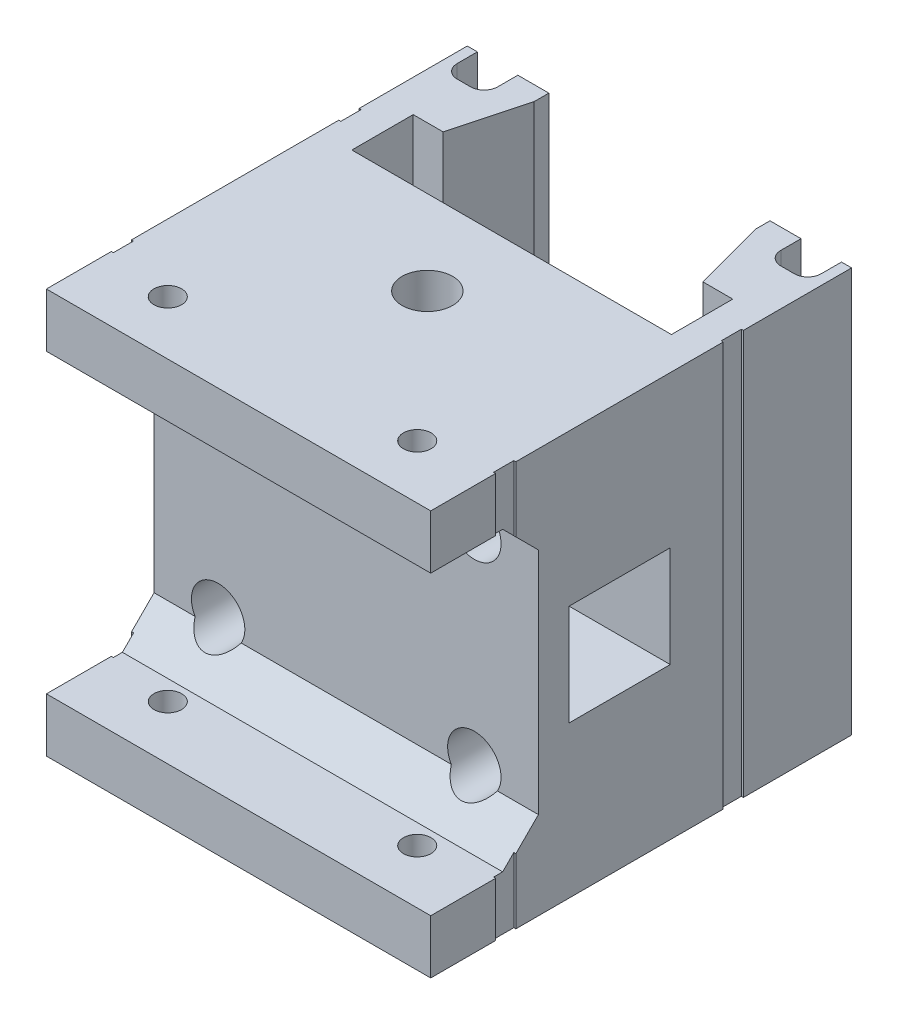
from build123d import *

# Parameters (mm, degrees)
SKETCH1_W            = 57
SKETCH1_H            = 28.7
BOSS_EXTRUDE1_DEPTH  = 60
SKETCH2_W            = 9
SKETCH2_H            = 4
CUT_EXTRUDE1_DEPTH   = 69.064473112
BOSS_EXTRUDE2_DEPTH  = 28.5
SKETCH6_W            = 15.5
SKETCH6_H            = 15.390476131
CUT_EXTRUDE2_DEPTH   = 80
BOSS_EXTRUDE5_DEPTH  = 60
SKETCH10_R           = 2
CUT_EXTRUDE3_DEPTH   = 24.530533394
SKETCH11_W           = 61.984050455
SKETCH11_H           = 43.227353824
SKETCH11_W_2         = 6
SKETCH11_H_2         = 2.542732203
CUT_EXTRUDE4_DEPTH   = 77.839254789
SKETCH13_W           = 6.011053281
SKETCH13_H           = 2.620549071
CUT_EXTRUDE5_DEPTH   = 77.839254789
SKETCH14_W           = 9
SKETCH14_H           = 4
BOSS_EXTRUDE7_DEPTH  = 60
SKETCH12_W           = 10.230058637
SKETCH12_H           = 6.686923691
BOSS_EXTRUDE6_DEPTH  = 60
SKETCH15_W           = 9
SKETCH15_H           = 4
BOSS_EXTRUDE8_DEPTH  = 60
SKETCH16_W           = 9
SKETCH16_H           = 1.78
CUT_EXTRUDE6_DEPTH   = 77.839254789
SKETCH17_W           = 25.75
SKETCH17_H           = 20.1006285
CUT_EXTRUDE7_DEPTH   = 77.839254789
SKETCH18_W           = 32.4
SKETCH18_H           = 12.613288226
CUT_EXTRUDE8_DEPTH   = 75.79485996
SKETCH19_W           = 57
SKETCH19_H           = 3.949842852
CUT_EXTRUDE9_DEPTH   = 75.79485996
SKETCH20_W           = 6
SKETCH20_H           = 3.5
CUT_EXTRUDE10_DEPTH  = 75.79485996
SKETCH21_W           = 6
SKETCH21_H           = 3.5
CUT_EXTRUDE11_DEPTH  = 1.5
SKETCH23_R           = 3.75
CUT_EXTRUDE12_DEPTH  = 59.313986952
SKETCH24_R           = 2
CUT_EXTRUDE13_DEPTH  = 59.313986952
SKETCH25_R           = 3.960956754
CUT_EXTRUDE14_DEPTH  = 10
SKETCH26_W           = 6
SKETCH26_H           = 10
SKETCH26_H_2         = 15
CUT_EXTRUDE15_DEPTH  = 5
SKETCH28_W           = 15.020317418
SKETCH28_H           = 14.99999997
CUT_EXTRUDE18_DEPTH  = 90.615964406
SKETCH32_W           = 57
SKETCH32_H           = 8
BOSS_EXTRUDE10_DEPTH = 15.97
SKETCH33_R           = 2.05
CUT_EXTRUDE20_DEPTH  = 84.351222025
FILLET2_R            = 2
CHAMFER1_SIZE        = 5
CUT_EXTRUDE21_DEPTH  = 84.351222025
SKETCH36_W           = 0.6
SKETCH36_H           = 3
CUT_EXTRUDE22_DEPTH  = 84.351222025


with BuildPart() as part:
    # Sketch1 → Boss-Extrude1 (new body)
    with BuildSketch(Plane(origin=(0, 0, 0), x_dir=(1, 0, 0), z_dir=(0, 1, 0))):
        with Locations((0, -0.5)):
            Rectangle(SKETCH1_W, SKETCH1_H)
        Polygon((23.07, -9.85), (-23.07, -9.85), (-23.5, -9.42), (-23.5, -0.95), (-19.09385128, -0.95), (-19, -0.599742255), (-16.2, 9.85), (16.2, 9.85), (19, -0.599742255), (19.09385128, -0.95), (23.5, -0.95), (23.5, -2.9), (23.5, -9.42), align=None, mode=Mode.SUBTRACT)
    extrude(amount=BOSS_EXTRUDE1_DEPTH)

    # Sketch2 → Cut-Extrude1 (cut, through all)
    with BuildSketch(Plane.XZ):
        with Locations((24, -10.0706285)):
            Rectangle(SKETCH2_W, SKETCH2_H)
        with Locations((-24, -10.0706285)):
            Rectangle(SKETCH2_W, SKETCH2_H)
    extrude(amount=-CUT_EXTRUDE1_DEPTH, mode=Mode.SUBTRACT)

    # Sketch5 → Boss-Extrude2 (add, symmetric)
    with BuildSketch(Plane(origin=(0, 0, 0), x_dir=(0, 0, -1), z_dir=(1, 0, 0))):
        with BuildLine():
            Line((-14.85, 0), (-14.85, 23.200000017))
            Line((-14.85, 23.200000017), (-15.549999973, 22.50000003))
            Line((-15.549999973, 22.50000003), (-29.149999973, 22.50000003))
            Line((-29.149999973, 22.50000003), (-29.849999973, 23.20000003))
            Line((-29.849999973, 23.20000003), (-29.849999973, 25.743360053))
            ThreePointArc((-29.849999973, 25.743360053), (-29.773879502, 26.126043492), (-29.557106746, 26.450466847))
            Line((-29.557106746, 26.450466847), (-27.237157266, 28.770416328))
            ThreePointArc((-27.237157266, 28.770416328), (-27.150448162, 28.900185674), (-27.119999973, 29.053259055))
            Line((-27.119999973, 29.053259055), (-27.119999973, 30.615319642))
            ThreePointArc((-27.119999973, 30.615319642), (-27.150448164, 30.768393021), (-27.237157268, 30.898162365))
            Line((-27.237157268, 30.898162365), (-27.431588163, 31.09259326))
            ThreePointArc((-27.431588163, 31.09259326), (-27.613507965, 31.297692563), (-27.620638933, 31.57175403))
            ThreePointArc((-27.620638933, 31.57175403), (-28.017573243, 32.42857618), (-28.828543655, 32.91234062))
            ThreePointArc((-28.828543655, 32.91234062), (-29.01918836, 33.020436377), (-29.124259054, 33.212764861))
            Line((-29.124259054, 33.212764861), (-29.156235284, 33.354092333))
            ThreePointArc((-29.156235284, 33.354092333), (-29.24659278, 33.53064407), (-29.410649592, 33.642090719))
            Line((-29.410649592, 33.642090719), (-29.585724304, 33.70524196))
            ThreePointArc((-29.585724304, 33.70524196), (-29.777329878, 33.851609246), (-29.849999973, 34.081511694))
            Line((-29.849999973, 34.081511694), (-29.849999973, 34.837490602))
            ThreePointArc((-29.849999973, 34.837490602), (-29.772088513, 35.074680338), (-29.568705112, 35.219471078))
            Line((-29.568705112, 35.219471078), (-29.427668799, 35.263299846))
            ThreePointArc((-29.427668799, 35.263299846), (-29.25116358, 35.375371369), (-29.155313737, 35.561185593))
            Line((-29.155313737, 35.561185593), (-29.125010632, 35.702102112))
            ThreePointArc((-29.125010632, 35.702102112), (-29.020526118, 35.897067182), (-28.828406063, 36.006695082))
            ThreePointArc((-28.828406063, 36.006695082), (-28.025619489, 36.481556021), (-27.62403672, 37.32339358))
            ThreePointArc((-27.62403672, 37.32339358), (-27.540484938, 37.407225271), (-27.43605838, 37.46293655))
            Line((-27.43605838, 37.46293655), (-27.39899493, 37.5))
            Line((-27.39899493, 37.5), (-17.30100503, 37.5))
            Line((-17.30100503, 37.5), (-17.26394158, 37.46293655))
            ThreePointArc((-17.26394158, 37.46293655), (-17.159515017, 37.407225278), (-17.07596324, 37.32339358))
            ThreePointArc((-17.07596324, 37.32339358), (-16.674380468, 36.481556018), (-15.871593887, 36.006695079))
            ThreePointArc((-15.871593887, 36.006695079), (-15.679473839, 35.897067189), (-15.574989331, 35.702102127))
            Line((-15.574989331, 35.702102127), (-15.544686222, 35.561185587))
            ThreePointArc((-15.544686222, 35.561185587), (-15.448836377, 35.375371364), (-15.272331158, 35.263299843))
            Line((-15.272331158, 35.263299843), (-15.131294869, 35.219471083))
            ThreePointArc((-15.131294869, 35.219471083), (-14.927911462, 35.074680333), (-14.85, 34.837490586))
            Line((-14.85, 34.837490586), (-14.85, 60))
            Line((-14.85, 60), (-34.380533394, 60))
            Line((-34.380533394, 60), (-34.380533394, 0))
            Line((-34.380533394, 0), (-14.85, 0))
        make_face()
        with BuildLine():
            ThreePointArc((-15.142893227, 26.450466847), (-14.926120471, 26.126043492), (-14.85, 25.743360053))
            Line((-14.85, 25.743360053), (-14.85, 34.081511674))
            ThreePointArc((-14.85, 34.081511674), (-14.922670087, 33.851609245), (-15.114275644, 33.70524197))
            Line((-15.114275644, 33.70524197), (-15.289350386, 33.642090718))
            ThreePointArc((-15.289350386, 33.642090718), (-15.453407192, 33.53064407), (-15.543764688, 33.354092339))
            Line((-15.543764688, 33.354092339), (-15.57574092, 33.21276486))
            ThreePointArc((-15.57574092, 33.21276486), (-15.680811613, 33.020436377), (-15.871456319, 32.91234062))
            ThreePointArc((-15.871456319, 32.91234062), (-16.68242673, 32.42857618), (-17.07936104, 31.57175403))
            ThreePointArc((-17.07936104, 31.57175403), (-17.086492012, 31.297692565), (-17.26841181, 31.09259326))
            Line((-17.26841181, 31.09259326), (-17.462842708, 30.898162362))
            ThreePointArc((-17.462842708, 30.898162362), (-17.549551812, 30.768393016), (-17.58, 30.615319635))
            Line((-17.58, 30.615319635), (-17.58, 29.053259048))
            ThreePointArc((-17.58, 29.053259048), (-17.54955181, 28.900185669), (-17.462842705, 28.770416325))
            Line((-17.462842705, 28.770416325), (-15.142893227, 26.450466847))
        make_face()
    extrude(amount=BOSS_EXTRUDE2_DEPTH, both=True)

    # Sketch6 → Cut-Extrude2 (cut)
    with BuildSketch(Plane(origin=(0, 60, 0), x_dir=(1, 0, 0), z_dir=(0, 1, 0))):
        with Locations((0, 12.050145064)):
            Rectangle(SKETCH6_W, SKETCH6_H)
    extrude(amount=-CUT_EXTRUDE2_DEPTH, mode=Mode.SUBTRACT)

    # Sketch9 → Boss-Extrude5 (add)
    with BuildSketch(Plane(origin=(0, 60, 0), x_dir=(1, 0, 0), z_dir=(0, 1, 0))):
        Polygon((-19.5, 13.85), (-19.5, 29.1706285), (-28.5, 29.1706285), (-28.5, 26.1706285), (-33.5, 26.1706285), (-33.5, 32.1706285), (-14.5, 32.1706285), (-14.5, 13.85), align=None)
        Polygon((30.2, 12.85), (30.2, 28.735786438), (19.5, 28.735786438), (19.5, 13.85), (14.5, 13.85), (14.5, 32.1706285), (33.5, 32.1706285), (33.5, 12.85), align=None)
    extrude(amount=-BOSS_EXTRUDE5_DEPTH)

    # Sketch10 → Cut-Extrude3 (cut)
    with BuildSketch(Plane.XY.offset(34.380533394)):
        with Locations((19, 45)):
            Circle(SKETCH10_R)
        with Locations((19, 15)):
            Circle(SKETCH10_R)
        with Locations((-19, 15)):
            Circle(SKETCH10_R)
        with Locations((-19, 45)):
            Circle(SKETCH10_R)
    extrude(amount=-CUT_EXTRUDE3_DEPTH, mode=Mode.SUBTRACT)

    # Sketch11 → Cut-Extrude4 (cut, through all)
    with BuildSketch(Plane.XZ):
        with Locations((44.734239641, -35.463676912)):
            Rectangle(SKETCH11_W, SKETCH11_H)
        with Locations((32.2, -12.566438328)):
            Rectangle(SKETCH11_W_2, SKETCH11_H_2)
    extrude(amount=-CUT_EXTRUDE4_DEPTH, mode=Mode.SUBTRACT)


with BuildPart() as cut_extrude4_piece_1:
    # of the separate pieces the step leaves, piece 1, a body of its own (cut_extrude4_pieces)
    add(part.part.solids().sort_by_distance((-28.5, 23.200000017, 14.85))[0])

    # Sketch14 → Boss-Extrude7 (add, through all)
    with BuildSketch(Plane(origin=(0, 0, 0), x_dir=(-1, 0, 0), z_dir=(0, -1, 0))):
        with Locations((-24, 10.0706285)):
            Rectangle(SKETCH14_W, SKETCH14_H)
    extrude(amount=-BOSS_EXTRUDE7_DEPTH)

    # Sketch12 → Boss-Extrude6 (add, through all)
    with BuildSketch(Plane.XZ):
        with Locations((23.384970682, -10.506538155)):
            Rectangle(SKETCH12_W, SKETCH12_H)
    extrude(amount=-BOSS_EXTRUDE6_DEPTH)

    # Sketch15 → Boss-Extrude8 (add, through all)
    with BuildSketch(Plane(origin=(0, 60, 0), x_dir=(1, 0, 0), z_dir=(0, 1, 0))):
        with Locations((-24, 10.0706285)):
            Rectangle(SKETCH15_W, SKETCH15_H)
    extrude(amount=-BOSS_EXTRUDE8_DEPTH)

    # Sketch16 → Cut-Extrude6 (cut, through all)
    with BuildSketch(Plane(origin=(0, 60, 0), x_dir=(1, 0, 0), z_dir=(0, 1, 0))):
        with Locations((-24, 12.96)):
            Rectangle(SKETCH16_W, SKETCH16_H)
    extrude(amount=-CUT_EXTRUDE6_DEPTH, mode=Mode.SUBTRACT)

    # Sketch17 → Cut-Extrude7 (cut, through all)
    with BuildSketch(Plane(origin=(0, 60, 0), x_dir=(1, 0, 0), z_dir=(0, 1, 0))):
        with Locations((-20.625, 22.12031425)):
            Rectangle(SKETCH17_W, SKETCH17_H)
    extrude(amount=-CUT_EXTRUDE7_DEPTH, mode=Mode.SUBTRACT)

    # Sketch18 → Cut-Extrude8 (cut, through all)
    with BuildSketch(Plane(origin=(0, 60, 0), x_dir=(1, 0, 0), z_dir=(0, 1, 0))):
        with Locations((0, 16.156644113)):
            Rectangle(SKETCH18_W, SKETCH18_H)
    extrude(amount=-CUT_EXTRUDE8_DEPTH, mode=Mode.SUBTRACT)

    # Sketch19 → Cut-Extrude9 (cut, through all)
    with BuildSketch(Plane(origin=(0, 60, 0), x_dir=(1, 0, 0), z_dir=(0, 1, 0))):
        with Locations((0, 14.044921426)):
            Rectangle(SKETCH19_W, SKETCH19_H)
    extrude(amount=-CUT_EXTRUDE9_DEPTH, mode=Mode.SUBTRACT)

    # Sketch20 → Cut-Extrude10 (cut, through all)
    with BuildSketch(Plane(origin=(0, 60, 0), x_dir=(1, 0, 0), z_dir=(0, 1, 0))):
        with Locations((-24, 8.82)):
            Rectangle(SKETCH20_W, SKETCH20_H)
        with Locations((24, 8.82)):
            Rectangle(SKETCH20_W, SKETCH20_H)
    extrude(amount=-CUT_EXTRUDE10_DEPTH, mode=Mode.SUBTRACT)

    # Sketch21 → Cut-Extrude11 (cut)
    with BuildSketch(Plane(origin=(0, 0, -12.07), x_dir=(-1, 0, 0), z_dir=(0, 0, -1))):
        with Locations((-24, 48.25)):
            Rectangle(SKETCH21_W, SKETCH21_H)
        with Locations((24, 48.25)):
            Rectangle(SKETCH21_W, SKETCH21_H)
        with Locations((24, 11.75)):
            Rectangle(SKETCH21_W, SKETCH21_H)
        with Locations((-24, 11.75)):
            Rectangle(SKETCH21_W, SKETCH21_H)
    extrude(amount=-CUT_EXTRUDE11_DEPTH, mode=Mode.SUBTRACT)

    # Sketch23 → Cut-Extrude12 (cut, through all)
    with BuildSketch(Plane(origin=(0, 22.50000003, 0), x_dir=(1, 0, 0), z_dir=(0, 1, 0))):
        with Locations(Location((0, -22.349999973, 0), (0, 0, 90))):
            Circle(SKETCH23_R)
    extrude(amount=CUT_EXTRUDE12_DEPTH, mode=Mode.SUBTRACT)

    # Sketch24 → Cut-Extrude13 (cut, through all)
    with BuildSketch(Plane(origin=(0, 22.50000003, 0), x_dir=(1, 0, 0), z_dir=(0, 1, 0))):
        with Locations(Location((0, -22.349999973, 0), (0, 0, 270))):
            Circle(SKETCH24_R)
    extrude(amount=-CUT_EXTRUDE13_DEPTH, mode=Mode.SUBTRACT)

    # Sketch25 → Cut-Extrude14 (cut)
    with BuildSketch(Plane.XY.offset(34.380533394)):
        with Locations((19, 15)):
            Circle(SKETCH25_R)
        with Locations((-19, 15)):
            Circle(SKETCH25_R)
        with Locations((19, 45)):
            Circle(SKETCH25_R)
        with Locations((-19, 45)):
            Circle(SKETCH25_R)
    extrude(amount=-CUT_EXTRUDE14_DEPTH, mode=Mode.SUBTRACT)

    # Sketch26 → Cut-Extrude15 (cut)
    with BuildSketch(Plane(origin=(0, 0, -12.07), x_dir=(-1, 0, 0), z_dir=(0, 0, -1))):
        with Locations((24, 30)):
            Rectangle(SKETCH26_W, SKETCH26_H)
        with Locations((24, 7.5)):
            Rectangle(SKETCH26_W, SKETCH26_H_2)
        with Locations((24, 52.5)):
            Rectangle(SKETCH26_W, SKETCH26_H_2)
        with Locations((-24, 30)):
            Rectangle(SKETCH26_W, SKETCH26_H)
        with Locations((-24, 52.5)):
            Rectangle(SKETCH26_W, SKETCH26_H_2)
        with Locations((-24, 7.5)):
            Rectangle(SKETCH26_W, SKETCH26_H_2)
    extrude(amount=-CUT_EXTRUDE15_DEPTH, mode=Mode.SUBTRACT)

    # Sketch28 → Cut-Extrude18 (cut, through all)
    with BuildSketch(Plane.ZY.offset(28.5)):
        with Locations((22.339841264, 30.000000015)):
            Rectangle(SKETCH28_W, SKETCH28_H)
    extrude(amount=-CUT_EXTRUDE18_DEPTH, mode=Mode.SUBTRACT)

    # Sketch32 → Boss-Extrude10 (add)
    with BuildSketch(Plane.XY.offset(34.380533394)):
        with Locations((0, 4)):
            Rectangle(SKETCH32_W, SKETCH32_H)
        with Locations((0, 56)):
            Rectangle(SKETCH32_W, SKETCH32_H)
    extrude(amount=BOSS_EXTRUDE10_DEPTH)

    # Sketch33 → Cut-Extrude20 (cut, through all)
    with BuildSketch(Plane(origin=(0, 60, 0), x_dir=(1, 0, 0), z_dir=(0, 1, 0))):
        with Locations(Location((18.5, -42.350533394, 0), (0, 0, 270))):
            Circle(SKETCH33_R)
        with Locations(Location((-18.5, -42.350533394, 0), (0, 0, 270))):
            Circle(SKETCH33_R)
    extrude(amount=-CUT_EXTRUDE20_DEPTH, mode=Mode.SUBTRACT)

    # Fillet2
    fillet2_edges = [cut_extrude4_piece_1.edges().sort_by_distance(p)[0] for p in [
        (-27, 30, -7.07),
        (-21, 30, -7.07),
        (27, 30, -7.07),
        (21, 30, -7.07),
        (-21, 15, -11.32),
        (-27, 15, -11.32),
        (-27, 45, -11.32),
        (-21, 45, -11.32),
        (21, 45, -11.32),
        (27, 45, -11.32),
        (27, 15, -11.32),
        (21, 15, -11.32),
    ]]
    fillet(fillet2_edges, radius=FILLET2_R)

    # Chamfer1
    # the kernel refuses this chamfer: 5 mm, written as the material it adds along each edge
    with BuildSketch(Plane(origin=(-28.5, 52, 34.380533394), x_dir=(0, 0.027495876610586317, 0.9996219169112968), z_dir=(1, 0, 0))) as chamfer1_piece_1_section:
        Polygon((CHAMFER1_SIZE * 0.999621916911, CHAMFER1_SIZE * 0.0274958766106), (-CHAMFER1_SIZE * 0.0274958766106, CHAMFER1_SIZE * 0.999621916911), (0, 0), align=None)
    chamfer1_piece_1 = extrude(amount=57, mode=Mode.PRIVATE)
    chamfer1_piece_1 = chamfer1_piece_1 - Plane(origin=(-19, 45, 36.059443485), x_dir=(1, 0, 0), z_dir=(0, 0, 1)) * Cylinder(3.960956754, 134, mode=Mode.PRIVATE)
    chamfer1_piece_1 = chamfer1_piece_1 - Plane(origin=(19, 45, 36.059443485), x_dir=(1, 0, 0), z_dir=(0, 0, 1)) * Cylinder(3.960956754, 134, mode=Mode.PRIVATE)
    add(chamfer1_piece_1)
    with BuildSketch(Plane(origin=(-28.5, 8, 34.380533394), x_dir=(0, 0.9996219169112968, -0.027495876610586317), z_dir=(1, 0, 0))) as chamfer1_piece_2_section:
        Polygon((CHAMFER1_SIZE * 0.999621916911, CHAMFER1_SIZE * 0.0274958766106), (-CHAMFER1_SIZE * 0.0274958766106, CHAMFER1_SIZE * 0.999621916911), (0, 0), align=None)
    chamfer1_piece_2 = extrude(amount=57, mode=Mode.PRIVATE)
    chamfer1_piece_2 = chamfer1_piece_2 - Plane(origin=(-19, 15, 36.059443438), x_dir=(1, 0, 0), z_dir=(0, 0, 1)) * Cylinder(3.960956754, 134, mode=Mode.PRIVATE)
    chamfer1_piece_2 = chamfer1_piece_2 - Plane(origin=(19, 15, 36.059443438), x_dir=(1, 0, 0), z_dir=(0, 0, 1)) * Cylinder(3.960956754, 134, mode=Mode.PRIVATE)
    add(chamfer1_piece_2)

    # Sketch35 → Cut-Extrude21 (cut, through all)
    with BuildSketch(Plane.XZ):
        Polygon((-16.2, -12.07), (-16.2, -9.85), (-19.09385128, 0.95), (-23.5, 0.95), (-23.5, 9.42), (-23.07, 9.85), (-23.7, 9.85), (-23.7, 0.75), (-19.247316678, 0.75), (-16.4, -9.8763305), (-16.4, -12.07), align=None)
        Polygon((16.4, -12.07), (16.2, -12.07), (16.2, -9.85), (19.09385128, 0.95), (23.5, 0.95), (23.5, 9.42), (23.07, 9.85), (23.7, 9.85), (23.7, 0.75), (19.247316678, 0.75), (16.4, -9.8763305), align=None)
    extrude(amount=-CUT_EXTRUDE21_DEPTH, mode=Mode.SUBTRACT)

    # Sketch36 → Cut-Extrude22 (cut, through all)
    with BuildSketch(Plane.XZ):
        with Locations((-28.5, 39.220890667)):
            Rectangle(SKETCH36_W, SKETCH36_H)
        with Locations((-28.5, 5.480176119)):
            Rectangle(SKETCH36_W, SKETCH36_H)
        with Locations((28.5, 5.480176119)):
            Rectangle(SKETCH36_W, SKETCH36_H)
        with Locations((28.5, 39.220890667)):
            Rectangle(SKETCH36_W, SKETCH36_H)
    extrude(amount=-CUT_EXTRUDE22_DEPTH, mode=Mode.SUBTRACT)


with BuildPart() as cut_extrude4_piece_2:
    # of the separate pieces the step leaves, piece 2, a body of its own (cut_extrude4_pieces)
    add(part.part.solids().sort_by_distance((33.5, 0, -13.85))[0])

    # Sketch13 → Cut-Extrude5 (cut, through all)
    with BuildSketch(Plane.XZ):
        with Locations((32.65361778, -14.054923964)):
            Rectangle(SKETCH13_W, SKETCH13_H)
    extrude(amount=-CUT_EXTRUDE5_DEPTH, mode=Mode.SUBTRACT)


solid = cut_extrude4_piece_1.part
